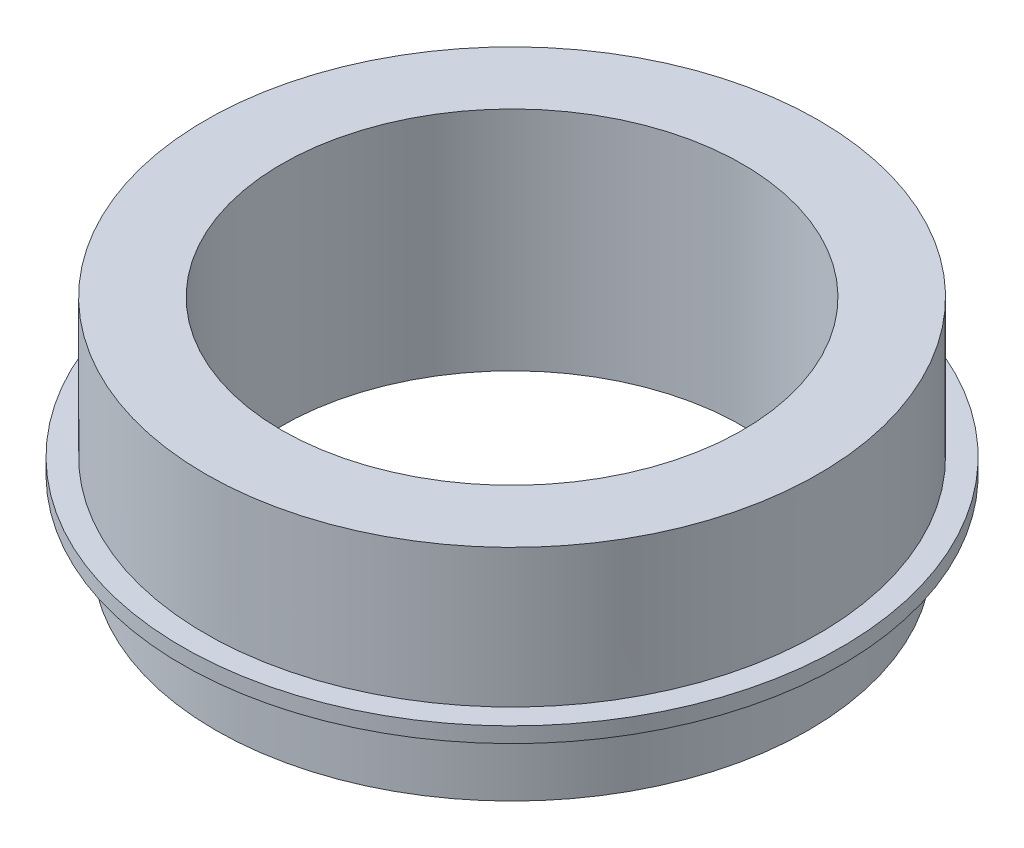
from build123d import *

# Parameters (mm, degrees)
SKETCH1_R           = 24.511
SKETCH1_R_2         = 19.05
BOSS_EXTRUDE1_DEPTH = 6.0452
SKETCH2_R           = 25.3365
SKETCH2_R_2         = 19.05
BOSS_EXTRUDE2_DEPTH = 12.7
SKETCH15_R          = 27.2415
SKETCH15_R_2        = 25.3365
BOSS_EXTRUDE3_DEPTH = 1.27


with BuildPart() as part:
    # Sketch1 → Boss-Extrude1 (new body)
    with BuildSketch(Plane(origin=(0, 0, 0), x_dir=(1, 0, 0), z_dir=(0, 1, 0))):
        Circle(SKETCH1_R)
        Circle(SKETCH1_R_2, mode=Mode.SUBTRACT)
    extrude(amount=BOSS_EXTRUDE1_DEPTH)

    # Sketch2 → Boss-Extrude2 (add)
    with BuildSketch(Plane(origin=(0, 6.0452, 0), x_dir=(1, 0, 0), z_dir=(0, 1, 0))):
        Circle(SKETCH2_R)
        Circle(SKETCH2_R_2, mode=Mode.SUBTRACT)
    extrude(amount=BOSS_EXTRUDE2_DEPTH)

    # Sketch15 → Boss-Extrude3 (add)
    with BuildSketch(Plane.XZ.offset(-6.0452)):
        Circle(SKETCH15_R)
        Circle(SKETCH15_R_2, mode=Mode.SUBTRACT)
    extrude(amount=-BOSS_EXTRUDE3_DEPTH)


solid = part.part
